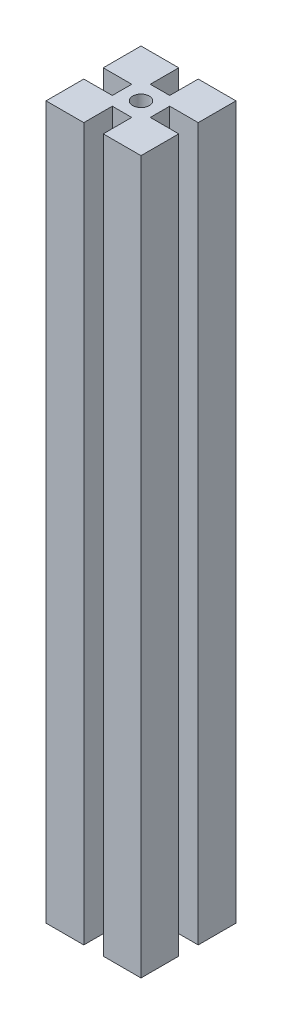
from build123d import *

# Parameters (mm, degrees)
SKIZZE1_R                       = 3.5
AUFSATZ_LINEAR_AUSTRAGEN1_DEPTH = 300


with BuildPart() as part:
    # Skizze1 → Aufsatz-Linear austragen1 (new body)
    with BuildSketch(Plane(origin=(0, 0, 0), x_dir=(1, 0, 0), z_dir=(0, 1, 0))):
        Polygon((-4.1, -20), (-4.1, -8), (4.1, -8), (4.1, -20), (20, -20), (20, -4.1), (8, -4.1), (8, 4.1), (20, 4.1), (20, 20), (4.1, 20), (4.1, 8), (-4.1, 8), (-4.1, 20), (-20, 20), (-20, 4.1), (-8, 4.1), (-8, -4.1), (-20, -4.1), (-20, -20), align=None)
        Circle(SKIZZE1_R, mode=Mode.SUBTRACT)
    extrude(amount=AUFSATZ_LINEAR_AUSTRAGEN1_DEPTH)


solid = part.part
